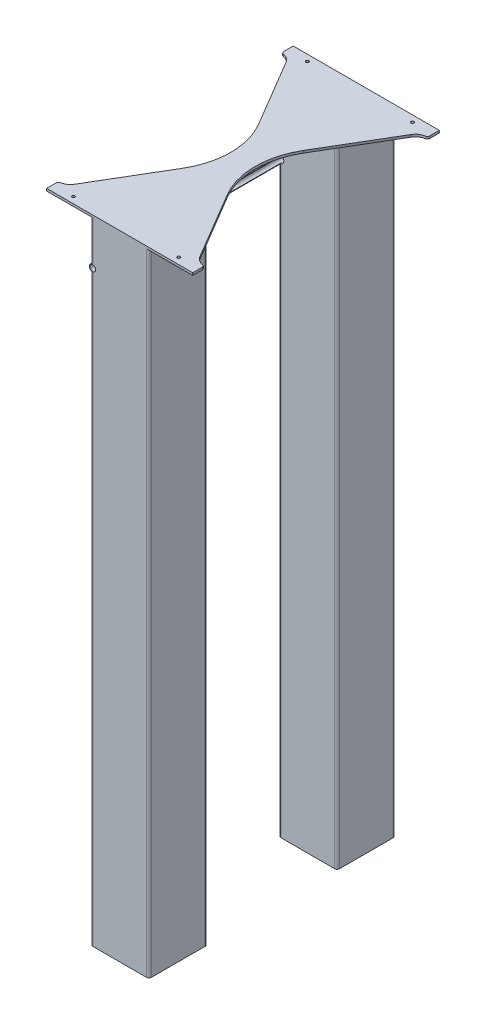
from build123d import *
from build123d.topology import SkipClean

# Parameters (mm, degrees)
SKETCH1_R           = 1.5875
BOSS_EXTRUDE1_DEPTH = 2.54
SKETCH2_W           = 63.5
SKETCH2_H           = 63.5
BOSS_EXTRUDE2_DEPTH = 685.8
SHELL1_START        = -688.34
SHELL1_OUTLINE_W    = 58.42
SHELL1_OUTLINE_H    = 58.42
SHELL1_DEPTH        = 685.8
FILLET1_R           = 2.54
FILLET2_R           = 2.54
CUT_EXTRUDE1_DEPTH  = 267.97
BOSS_EXTRUDE4_DEPTH = 27.94
BOSS_EXTRUDE5_DEPTH = 10.16
BOSS_EXTRUDE6_START = -0.762
BOSS_EXTRUDE6_DEPTH = 0.762
BOSS_EXTRUDE7_DEPTH = 0.762
BOSS_EXTRUDE8_DEPTH = 229.108
SKETCH12_W          = 2.54
SKETCH12_H          = 18.920978
CUT_EXTRUDE2_DEPTH  = 10.16


# Read off the part's stored shape, not the designer's step: Shell1
with BuildPart() as part:
    # Sketch1 → Boss-Extrude1 (new body)
    with BuildSketch(Plane(origin=(0, 0, 0), x_dir=(1, 0, 0), z_dir=(0, 1, 0))):
        with BuildLine():
            Line((-79.375, -133.985), (79.375, -133.985))
            Line((79.375, -133.985), (79.375, -123.618732))
            ThreePointArc((79.375, -123.618732), (78.770533, -121.973949), (77.244833, -121.112014))
            ThreePointArc((77.244833, -121.112014), (71.931312, -118.986411), (68.016546, -114.811929))
            Line((68.016546, -114.811929), (24.542449, -41.427653))
            ThreePointArc((24.542449, -41.427653), (13.192327, 0), (24.542449, 41.427653))
            Line((24.542449, 41.427653), (68.016546, 114.811929))
            ThreePointArc((68.016546, 114.811929), (71.931312, 118.986411), (77.244833, 121.112014))
            ThreePointArc((77.244833, 121.112014), (78.770533, 121.973949), (79.375, 123.618732))
            Line((79.375, 123.618732), (79.375, 133.985))
            Line((79.375, 133.985), (-79.375, 133.985))
            Line((-79.375, 133.985), (-79.375, 123.618732))
            ThreePointArc((-79.375, 123.618732), (-78.770533, 121.973949), (-77.244833, 121.112014))
            ThreePointArc((-77.244833, 121.112014), (-71.931312, 118.986411), (-68.016546, 114.811929))
            Line((-68.016546, 114.811929), (-24.542449, 41.427653))
            ThreePointArc((-24.542449, 41.427653), (-13.192327, 0), (-24.542449, -41.427653))
            Line((-24.542449, -41.427653), (-68.016546, -114.811929))
            ThreePointArc((-68.016546, -114.811929), (-71.931312, -118.986411), (-77.244833, -121.112014))
            ThreePointArc((-77.244833, -121.112014), (-78.770533, -121.973949), (-79.375, -123.618732))
            Line((-79.375, -123.618732), (-79.375, -133.985))
        make_face()
        with Locations(Location((-57.15, 127, 0), (0, 0, 270))):
            Circle(SKETCH1_R, mode=Mode.SUBTRACT)
        with Locations(Location((57.15, 127, 0), (0, 0, 270))):
            Circle(SKETCH1_R, mode=Mode.SUBTRACT)
        with Locations(Location((57.15, -127, 0), (0, 0, 90))):
            Circle(SKETCH1_R, mode=Mode.SUBTRACT)
        with Locations(Location((-57.15, -127, 0), (0, 0, 90))):
            Circle(SKETCH1_R, mode=Mode.SUBTRACT)
    extrude(amount=-BOSS_EXTRUDE1_DEPTH)

    # Sketch2 → Boss-Extrude2 (add)
    with BuildSketch(Plane.XZ.offset(2.54)):
        with Locations((0, -102.235)):
            Rectangle(SKETCH2_W, SKETCH2_H)
        with Locations((0, 102.235)):
            Rectangle(SKETCH2_W, SKETCH2_H)
    extrude(amount=BOSS_EXTRUDE2_DEPTH)

    # Shell1 outline → Shell1 (cut)
    with BuildSketch(Plane(origin=(0, 0, 0), x_dir=(1, 0, 0), z_dir=(0, 1, 0)).offset(SHELL1_START)):
        with Locations((0, 102.235)):
            Rectangle(SHELL1_OUTLINE_W, SHELL1_OUTLINE_H)
        with Locations((0, -102.235)):
            Rectangle(SHELL1_OUTLINE_W, SHELL1_OUTLINE_H)
    extrude(amount=SHELL1_DEPTH, mode=Mode.SUBTRACT)

    # Fillet1
    fillet1_edges = [part.edges().sort_by_distance(p)[0] for p in [
        (31.75, -345.44, 70.485),
        (31.75, -345.44, 133.985),
        (-31.75, -345.44, 133.985),
        (-31.75, -345.44, 70.485),
    ]]
    fillet(fillet1_edges, radius=FILLET1_R)

    # Fillet2
    fillet2_edges = [part.edges().sort_by_distance(p)[0] for p in [
        (-31.75, -345.44, -70.485),
        (-31.75, -345.44, -133.985),
        (31.75, -345.44, -133.985),
        (31.75, -345.44, -70.485),
    ]]
    fillet(fillet2_edges, radius=FILLET2_R)

    # Sketch4 → Cut-Extrude1 (cut)
    with BuildSketch(Plane(origin=(0, 0, -133.985), x_dir=(-1, 0, 0), z_dir=(0, 0, -1))):
        with BuildLine():
            ThreePointArc((29.21, -53.213), (31.455064, -52.283064), (32.385, -50.038))
            ThreePointArc((32.385, -50.038), (31.455064, -47.792936), (29.21, -46.863))
            Line((29.21, -46.863), (29.21, -53.213))
        make_face()
        with BuildLine():
            Line((29.21, -53.213), (29.21, -46.863))
            ThreePointArc((29.21, -46.863), (26.035, -50.038), (29.21, -53.213))
        make_face()
    extrude(amount=-CUT_EXTRUDE1_DEPTH, mode=Mode.SUBTRACT)

    # Sketch6 → Boss-Extrude4 (add)
    with BuildSketch(Plane(origin=(0, 0, -133.985), x_dir=(-1, 0, 0), z_dir=(0, 0, -1))):
        with BuildLine():
            Line((29.21, -46.863), (29.21, -46.228))
            ThreePointArc((29.21, -46.228), (33.02, -50.038), (29.21, -53.848))
            Line((29.21, -53.848), (29.21, -53.213))
            ThreePointArc((29.21, -53.213), (32.385, -50.038), (29.21, -46.863))
        make_face()
    extrude(amount=-BOSS_EXTRUDE4_DEPTH)

    # Sketch7 → Boss-Extrude5 (add)
    with BuildSketch(Plane.XY.offset(-106.045)):
        with BuildLine():
            ThreePointArc((-31.75, -40.069511), (-39.497, -50.038), (-31.75, -60.006489))
            Line((-31.75, -60.006489), (-31.75, -59.218089))
            ThreePointArc((-31.75, -59.218089), (-38.735, -50.038), (-31.75, -40.857911))
            Line((-31.75, -40.857911), (-31.75, -40.069511))
        make_face()
    extrude(amount=BOSS_EXTRUDE5_DEPTH)

    # Sketch7<2> → Boss-Extrude6 (add)
    with BuildSketch(Plane.XY.offset(-106.045).offset(BOSS_EXTRUDE6_START)):
        with BuildLine():
            ThreePointArc((-31.75, -40.069511), (-39.497, -50.038), (-31.75, -60.006489))
            Line((-31.75, -60.006489), (-31.75, -59.218089))
            ThreePointArc((-31.75, -59.218089), (-38.735, -50.038), (-31.75, -40.857911))
            Line((-31.75, -40.857911), (-31.75, -40.069511))
        make_face()
        with BuildLine():
            ThreePointArc((-31.75, -40.857911), (-38.735, -50.038), (-31.75, -59.218089))
            Line((-31.75, -59.218089), (-31.75, -52.877806))
            ThreePointArc((-31.75, -52.877806), (-33.02, -50.038), (-31.75, -47.198194))
            Line((-31.75, -47.198194), (-31.75, -40.857911))
        make_face()
    extrude(amount=BOSS_EXTRUDE6_DEPTH)

    # Sketch8 → Boss-Extrude7 (add)
    with SkipClean():  # the faces are left unmerged after this step: merging them gives an invalid solid
        with BuildSketch(Plane.XY.offset(-95.885)):
            with BuildLine():
                Line((-31.75, -40.069511), (-31.75, -48.133))
                ThreePointArc((-31.75, -48.133), (-32.385, -50.038), (-31.75, -51.943))
                Line((-31.75, -51.943), (-31.75, -60.006489))
                ThreePointArc((-31.75, -60.006489), (-39.497, -50.038), (-31.75, -40.069511))
            make_face()
        extrude(amount=BOSS_EXTRUDE7_DEPTH)

    # Sketch9 → Boss-Extrude8 (add)
    with SkipClean():  # the faces are left unmerged after this step: merging them gives an invalid solid
        with BuildSketch(Plane.XY.offset(-95.123)):
            with BuildLine():
                Line((-29.21, -46.228), (-29.21, -46.863))
                ThreePointArc((-29.21, -46.863), (-30.629903, -47.198194), (-31.75, -48.133))
                ThreePointArc((-31.75, -48.133), (-32.385, -50.038), (-31.75, -51.943))
                ThreePointArc((-31.75, -51.943), (-30.629903, -52.877806), (-29.21, -53.213))
                Line((-29.21, -53.213), (-29.21, -53.848))
                ThreePointArc((-29.21, -53.848), (-33.02, -50.038), (-29.21, -46.228))
            make_face()
        extrude(amount=BOSS_EXTRUDE8_DEPTH)

    # Sketch12 → Cut-Extrude2 (cut)
    with BuildSketch(Plane(origin=(0, 0, -95.885), x_dir=(-1, 0, 0), z_dir=(0, 0, -1))):
        with Locations((30.48, -50.038)):
            Rectangle(SKETCH12_W, SKETCH12_H)
    extrude(amount=CUT_EXTRUDE2_DEPTH, mode=Mode.SUBTRACT)


solid = part.part
